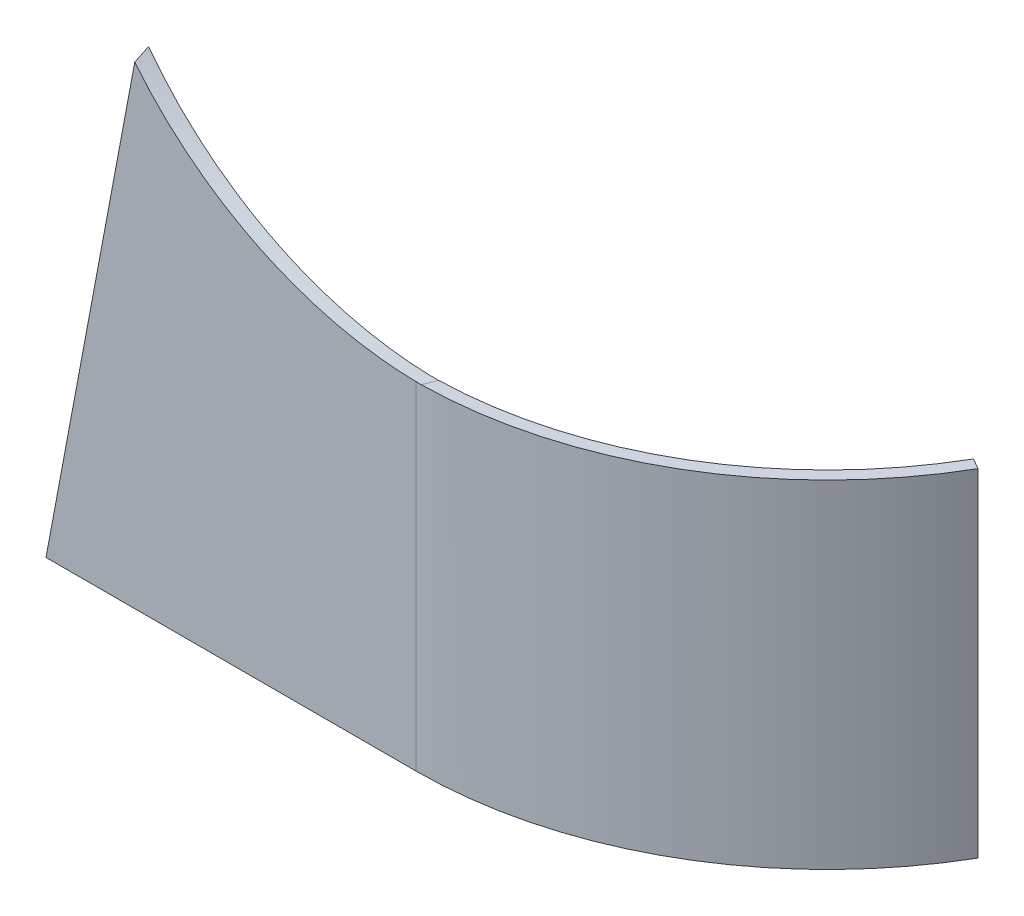
from build123d import *

# Parameters (mm, degrees)
BASE_FLANGE1_DEPTH = 120
CUT_EXTRUDE1_DEPTH = 10


# Sheet-metal steps are written as plain solids
with BuildPart() as part:
    # Sketch1 → Base-Flange1 (new body)
    with BuildSketch(Plane(origin=(0, 0, 0), x_dir=(1, 0, 0), z_dir=(0, 1, 0))):
        with BuildLine():
            Line((122.5, 0), (212.5, 0))
            ThreePointArc((212.5, 0), (262.5, 13.397459622), (299.102540378, 50))
            Line((299.102540378, 50), (296.504464167, 51.5))
            ThreePointArc((296.504464167, 51.5), (261, 15.995535833), (212.5, 3))
            Line((212.5, 3), (122.5, 3))
            Line((122.5, 3), (122.5, 0))
        make_face()
    extrude(amount=BASE_FLANGE1_DEPTH)

    # Sketch6 → Cut-Extrude1 (cut)
    with BuildSketch(Plane.XY):
        Polygon((122.5, 120), (145, 120), (122.5, 0), align=None)
    extrude(amount=-CUT_EXTRUDE1_DEPTH, mode=Mode.SUBTRACT)

    # Sketch12 → Cut-Revolve1 (revolve, cut)
    with BuildSketch(Plane(origin=(25.631243638, 0, -75.648490011), x_dir=(0.8356082783221033, 0, 0.5493257732890113), z_dir=(0.5493257732890113, 0, -0.8356082783221033))):
        with BuildLine():
            Line((202.75, -82), (370.763557892, -82))
            Line((370.763557892, -82), (370.763557892, -132))
            Line((370.763557892, -132), (132.039321881, -132))
            ThreePointArc((132.039321881, -132), (159.448729811, -95.76275643), (202.75, -82))
        make_face()
    revolve(axis=Axis((25.631243638, 0, -75.648490011), (0, -1, 0)), mode=Mode.SUBTRACT)


solid = part.part
